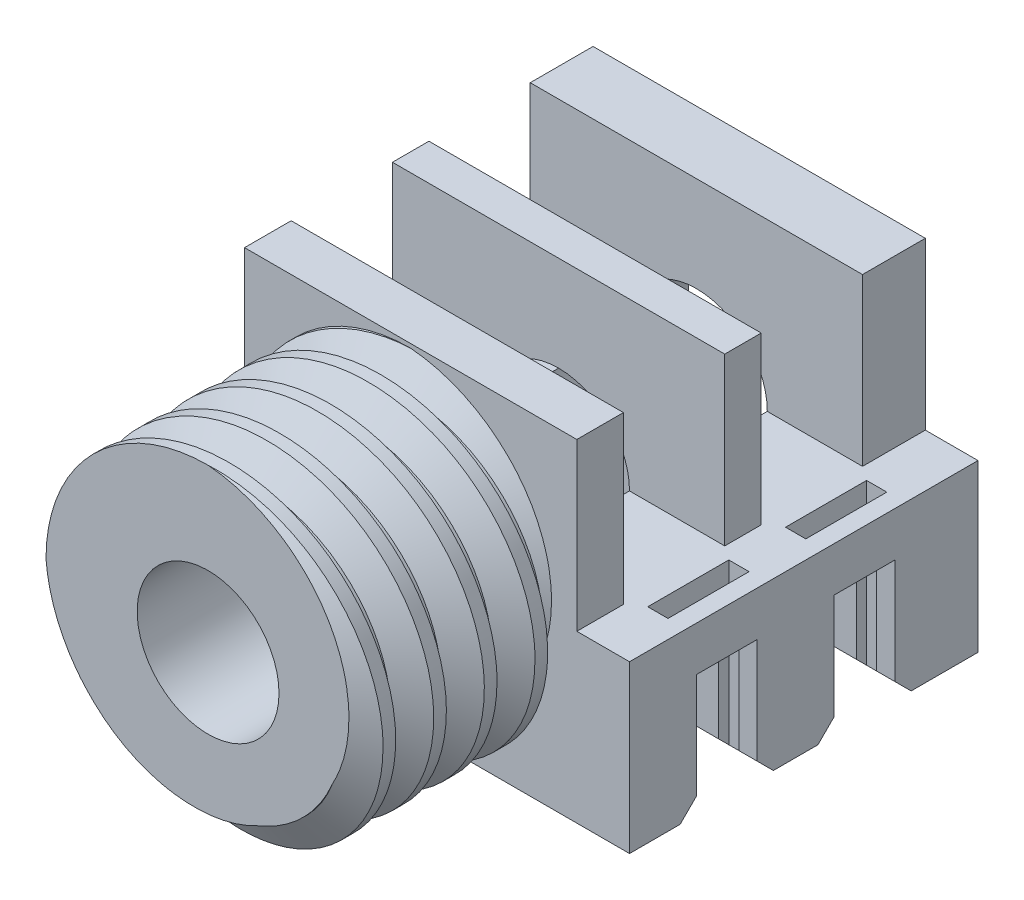
from build123d import *

# Parameters (mm, degrees)
SKETCH1_R               = 4
BOSS_EXTRUDE1_DEPTH     = 5
BOSS_EXTRUDE2_DEPTH     = 8.6
CUT_EXTRUDE1_DEPTH      = 15.401736006
CUT_EXTRUDE1_DEPTH_BACK = 15.401736006
SKETCH3_W               = 2.5
SKETCH3_H               = 4.1
SKETCH4_W               = 0.5
SKETCH4_H               = 2
CUT_EXTRUDE2_DEPTH      = 8.6
SKETCH5_R               = 1.75
CUT_EXTRUDE3_DEPTH      = 16.196381148
THREAD1_PITCH           = 1.25
THREAD1_TO              = 6.25
CUT_EXTRUDE4_DEPTH      = 15.40173611


with BuildPart() as part:
    # Sketch1 → Boss-Extrude1 (new body)
    with BuildSketch(Plane.XY):
        Circle(SKETCH1_R)
    extrude(amount=BOSS_EXTRUDE1_DEPTH)

    # Sketch2 → Boss-Extrude2 (add)
    with BuildSketch(Plane(origin=(0, 0, 0), x_dir=(-1, 0, 0), z_dir=(0, 0, -1))):
        Polygon((-4.1, 4.1), (4.1, 4.1), (4.1, 0), (5.4, 0), (5.4, -4.1), (-5.4, -4.1), (-5.4, 0), (-4.1, 0), align=None)
    extrude(amount=BOSS_EXTRUDE2_DEPTH)

    # Sketch3 → Cut-Extrude1 (cut, two sides: drawn at the far end of the back side and taken through both)
    with BuildSketch(Plane.ZY.offset(5.4).offset(-CUT_EXTRUDE1_DEPTH_BACK)):
        with Locations((-2.4, 2.05)):
            Rectangle(SKETCH3_W, SKETCH3_H)
        with Locations((-5.8, 2.05)):
            Rectangle(SKETCH3_W, SKETCH3_H)
        Polygon((-5.8, -1.1), (-6.55, -1.1), (-6.55, -4.1), (-5.8, -4.1), (-5.05, -4.1), (-5.05, -1.1), align=None)
        Polygon((-2.4, -4.1), (-1.65, -4.1), (-1.65, -1.1), (-2.4, -1.1), (-3.15, -1.1), (-3.15, -4.1), align=None)
    extrude(amount=CUT_EXTRUDE1_DEPTH + CUT_EXTRUDE1_DEPTH_BACK, mode=Mode.SUBTRACT)

    # Sketch4 → Cut-Extrude2 (cut)
    with BuildSketch(Plane.XZ.offset(4.1)):
        with Locations((4.7, -2.4)):
            Rectangle(SKETCH4_W, SKETCH4_H)
        with Locations((-4.7, -2.4)):
            Rectangle(SKETCH4_W, SKETCH4_H)
        with Locations((4.7, -5.8)):
            Rectangle(SKETCH4_W, SKETCH4_H)
        with Locations((-4.7, -5.8)):
            Rectangle(SKETCH4_W, SKETCH4_H)
    extrude(amount=-CUT_EXTRUDE2_DEPTH, mode=Mode.SUBTRACT)

    # Sketch5 → Cut-Extrude3 (cut, through all)
    with BuildSketch(Plane.XY.offset(5)):
        Circle(SKETCH5_R)
    extrude(amount=-CUT_EXTRUDE3_DEPTH, mode=Mode.SUBTRACT)

    # Thread1: arcs per turn and ends read off the stored shape
    # Thread1: the profile of Thread Profile1 profile screwed along a right-hand helix through 5.2 turns, 8 arcs to a turn; built about Z, then put on its axis
    thread1_z = Axis((0, 0, 0), (0, 0, 1))
    thread1_corners = [(4.0003, 0, -0.000173205), (3.323417656, 0, 0.390624998), (3.323417656, 0, 0.546874998), (4.0003, 0, 0.937673202)]
    with BuildLine(mode=Mode.PRIVATE) as thread1_profile:
        Line(thread1_corners[0], thread1_corners[1])
        Line(thread1_corners[1], thread1_corners[2])
        Line(thread1_corners[2], thread1_corners[3])
        Line(thread1_corners[3], thread1_corners[0])
    thread1_cap = Face(thread1_profile.wire())
    thread1_turn_angles = [0, 22.5, 45, 67.5, 90, 112.5, 135, 157.5, 180, 202.5, 225, 247.5, 270, 292.5, 315, 337.5, 360]
    thread1_turn_weights = [1, 0.9238795325112867, 1, 0.9238795325112867, 1, 0.9238795325112867, 1, 0.9238795325112867, 1, 0.9238795325112867, 1, 0.9238795325112867, 1, 0.9238795325112867, 1, 0.9238795325112867, 1]
    thread1_turn_rails = [Edge.make_bspline([Vector(p[0], p[1], 0).rotate(thread1_z, thread1_turn_angles[k]) / thread1_turn_weights[k] + Vector(0, 0, p[2] + THREAD1_PITCH * thread1_turn_angles[k] / 360) for k in range(17)], [0, 0, 0, 1, 1, 2, 2, 3, 3, 4, 4, 5, 5, 6, 6, 7, 7, 8, 8, 8], 2, thread1_turn_weights) for p in thread1_corners]
    thread1_turn_sides = [Face.make_surface_from_curves(thread1_turn_rails[p[0]], thread1_turn_rails[p[1]]) for p in [(0, 1), (1, 2), (2, 3), (3, 0)]]
    thread1_last_angles = [1800, 1822.5, 1845, 1858.5, 1872]
    thread1_last_weights = [1, 0.9238795325112867, 1, 0.9723699203976766, 1]
    thread1_last_rails = [Edge.make_bspline([Vector(p[0], p[1], 0).rotate(thread1_z, thread1_last_angles[k]) / thread1_last_weights[k] + Vector(0, 0, p[2] + THREAD1_PITCH * thread1_last_angles[k] / 360) for k in range(5)], [0, 0, 0, 1, 1, 2, 2, 2], 2, thread1_last_weights) for p in thread1_corners]
    thread1_last_sides = [Face.make_surface_from_curves(thread1_last_rails[p[0]], thread1_last_rails[p[1]]) for p in [(0, 1), (1, 2), (2, 3), (3, 0)]]
    thread1 = Plane(origin=(0, 0, 6.25), x_dir=(-1, 0, 0), z_dir=(0, 0, -1)) * split(Solid(Shell([*[p.moved(Location((0, 0, THREAD1_PITCH * i))) for i in range(5) for p in thread1_turn_sides], *thread1_last_sides, thread1_cap, thread1_cap.rotate(thread1_z, 1872).moved(Location((0, 0, THREAD1_PITCH * 1872 / 360)))])), bisect_by=Plane.XY.offset(THREAD1_TO), keep=Keep.BOTTOM, mode=Mode.PRIVATE)
    add(thread1, mode=Mode.SUBTRACT)

    # Sketch10 → Cut-Extrude4 (cut, through all)
    with BuildSketch(Plane.ZY.offset(5.4)):
        Polygon((-6.55, -4.1), (-6.55, -3.7), (-6.95, -4.1), align=None)
        Polygon((-5.05, -4.1), (-5.05, -3.7), (-4.65, -4.1), align=None)
        Polygon((-3.15, -4.1), (-3.55, -4.1), (-3.15, -3.7), align=None)
        Polygon((-1.65, -4.1), (-1.65, -3.7), (-1.25, -4.1), align=None)
    extrude(amount=-CUT_EXTRUDE4_DEPTH, mode=Mode.SUBTRACT)


solid = part.part
